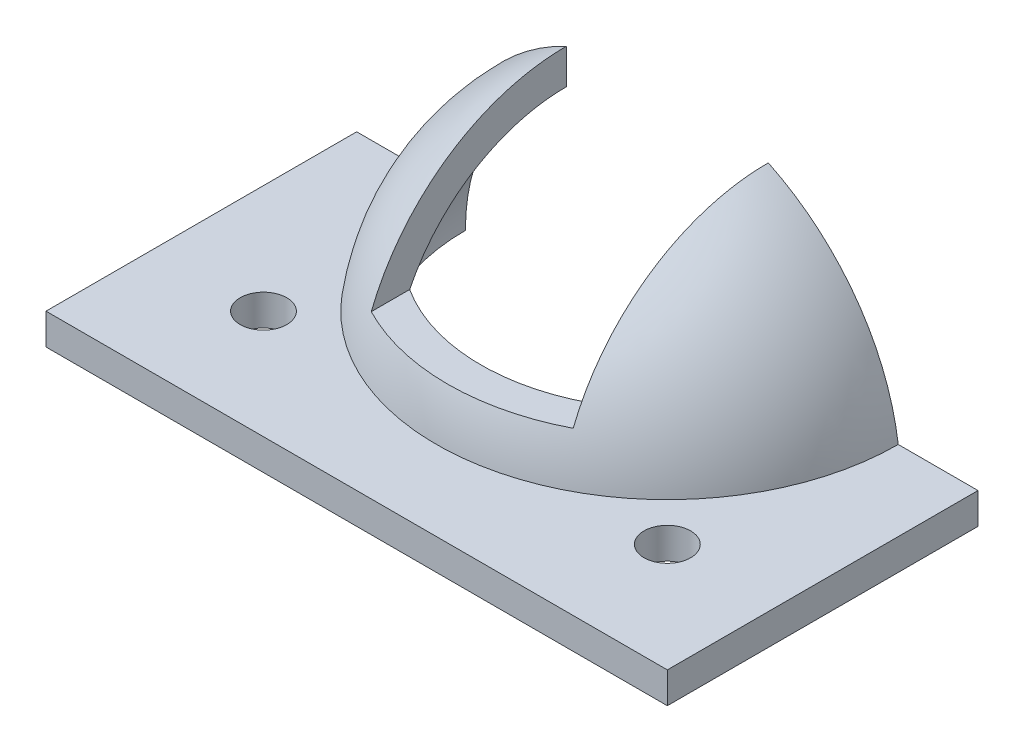
from build123d import *

# Parameters (mm, degrees)
SKETCH2_W            = 16.51
SKETCH2_H            = 16.418842622
CUT_EXTRUDE1_DEPTH   = 63.5
SKETCH3_W            = 50.8
SKETCH3_H            = 50.8
SKETCH3_R            = 16.51
BOSS_EXTRUDE1_DEPTH  = 2.54
SKETCH5_R            = 1.905
CUT_EXTRUDE3_DEPTH   = 39.785475152
LPATTERN1_COUNT      = 2
LPATTERN1_PITCH      = 33.02
LPATTERN1_COUNT_DIR2 = 2
LPATTERN1_PITCH_DIR2 = 33.02
SKETCH6_W            = 56.281524163
SKETCH6_H            = 20.147031274
CUT_EXTRUDE4_DEPTH   = 40.813031472


with BuildPart() as part:
    # Sketch1 → Revolve1 (revolve)
    with BuildSketch(Plane.XY):
        with BuildLine():
            Line((19.05, 0), (16.51, 0))
            ThreePointArc((16.51, 0), (11.674332957, 11.674332957), (0, 16.51))
            Line((0, 16.51), (0, 19.05))
            ThreePointArc((0, 19.05), (13.470384182, 13.470384182), (19.05, 0))
        make_face()
    revolve(axis=Axis((0, 19.05, 0), (0, -1, 0)))

    # Sketch2 → Cut-Extrude1 (cut, symmetric)
    with BuildSketch(Plane.XY):
        with Locations((0, 14.559421311)):
            Rectangle(SKETCH2_W, SKETCH2_H)
    extrude(amount=CUT_EXTRUDE1_DEPTH, both=True, mode=Mode.SUBTRACT)

    # Sketch3 → Boss-Extrude1 (add)
    with BuildSketch(Plane.XZ):
        Rectangle(SKETCH3_W, SKETCH3_H)
        Circle(SKETCH3_R, mode=Mode.SUBTRACT)
    extrude(amount=-BOSS_EXTRUDE1_DEPTH)

    # Sketch5 → Cut-Extrude3 (cut, through all)
    with BuildSketch(Plane(origin=(0, 2.54, 0), x_dir=(1, 0, 0), z_dir=(0, 1, 0))):
        with Locations((-16.51, 16.51)):
            Circle(SKETCH5_R)
    cut_extrude3 = extrude(amount=-CUT_EXTRUDE3_DEPTH, mode=Mode.SUBTRACT)

    # LPattern1: Cut-Extrude3 2 × 2
    with Locations(*[(i * LPATTERN1_PITCH, 0, j * LPATTERN1_PITCH_DIR2) for i in range(LPATTERN1_COUNT) for j in range(LPATTERN1_COUNT_DIR2) if (i, j) != (0, 0)]):
        add(cut_extrude3, mode=Mode.SUBTRACT)

    # Sketch6 → Cut-Extrude4 (cut, through all)
    with BuildSketch(Plane.XY):
        with Locations((0.297112119, 7.848545007)):
            Rectangle(SKETCH6_W, SKETCH6_H)
    extrude(amount=-CUT_EXTRUDE4_DEPTH, mode=Mode.SUBTRACT)


solid = part.part
